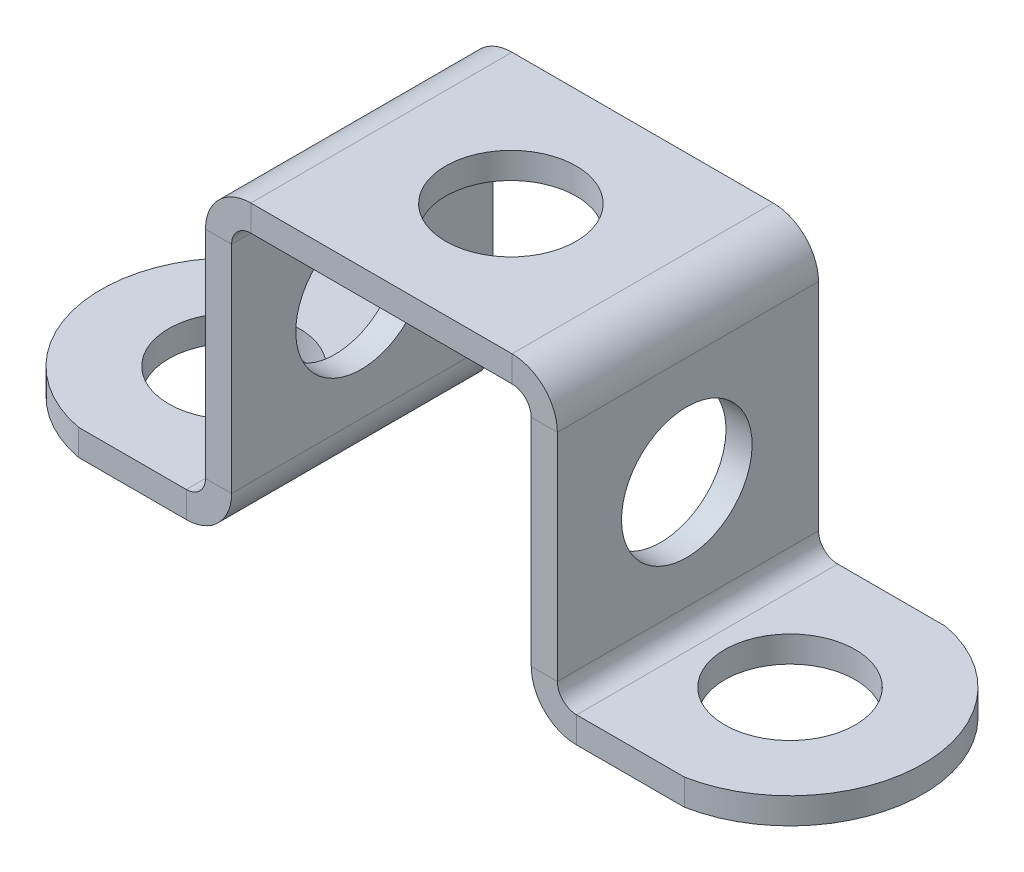
from build123d import *

# Parameters (mm, degrees)
SKETCH1_W               = 10
SKETCH1_H               = 10
BASE_FLANGE1_DEPTH      = 1
EDGE_FLANGE2_DEPTH      = 10
EDGE_FLANGE2_BEND_DEPTH = 10
EDGE_FLANGE3_DEPTH      = 10
EDGE_FLANGE3_BEND_DEPTH = 10
CUT_EXTRUDE1_DEPTH      = 10
SKETCH25_R              = 2.5
CUT_EXTRUDE2_DEPTH      = 10
SKETCH26_R              = 2.5
CUT_EXTRUDE3_DEPTH      = 10
SKETCH27_R              = 2.5
CUT_EXTRUDE4_DEPTH      = 1


# Sheet-metal steps are written as plain solids
with BuildPart() as part:
    # Sketch1 → Base-Flange1 (new body)
    with BuildSketch(Plane(origin=(0, 0, 0), x_dir=(1, 0, 0), z_dir=(0, 1, 0))):
        with Locations((0, 0.042787107)):
            Rectangle(SKETCH1_W, SKETCH1_H)
    extrude(amount=-BASE_FLANGE1_DEPTH)

    # Edge-Flange2 section (across the edge) → Edge-Flange2 (add)
    with BuildSketch(Plane(origin=(5.7366, -1, -5.042787107), x_dir=(-1, 0, 0), z_dir=(0, 0, 1))):
        with BuildLine():
            Line((-1, 0.7366), (-1, 9))
            Line((-1, 9), (0, 9))
            Line((0, 9), (0, 0.7366))
            ThreePointArc((0, 0.7366), (0.215745145, 0.215745145), (0.7366, 0))
            Line((0.7366, 0), (0.7366, -1))
            ThreePointArc((0.7366, -1), (-0.491361636, -0.491361636), (-1, 0.7366))
        make_face()
    extrude(amount=EDGE_FLANGE2_DEPTH)

    # Edge-Flange2 section 2 (across the edge) → Edge-Flange2 bend (add)
    with BuildSketch(Plane(origin=(-5.7366, -1, 4.957212893), x_dir=(1, 0, 0), z_dir=(0, 0, -1))):
        with BuildLine():
            Line((-1, 0.7366), (-1, 9))
            Line((-1, 9), (0, 9))
            Line((0, 9), (0, 0.7366))
            ThreePointArc((0, 0.7366), (0.215745145, 0.215745145), (0.7366, 0))
            Line((0.7366, 0), (0.7366, -1))
            ThreePointArc((0.7366, -1), (-0.491361636, -0.491361636), (-1, 0.7366))
        make_face()
    extrude(amount=EDGE_FLANGE2_BEND_DEPTH)

    # Edge-Flange3 section (across the edge) → Edge-Flange3 (add)
    with BuildSketch(Plane(origin=(6.7366, -10.7366, 4.957212893), x_dir=(0, 1, 0), z_dir=(0, 0, -1))):
        with BuildLine():
            Line((-1, 0.7366), (-1, 9))
            Line((-1, 9), (0, 9))
            Line((0, 9), (0, 0.7366))
            ThreePointArc((0, 0.7366), (0.215745145, 0.215745145), (0.7366, 0))
            Line((0.7366, 0), (0.7366, -1))
            ThreePointArc((0.7366, -1), (-0.491361636, -0.491361636), (-1, 0.7366))
        make_face()
    extrude(amount=EDGE_FLANGE3_DEPTH)

    # Edge-Flange3 section 2 (across the edge) → Edge-Flange3 bend (add)
    with BuildSketch(Plane(origin=(-6.7366, -10.7366, -5.042787107), x_dir=(0, 1, 0), z_dir=(0, 0, 1))):
        with BuildLine():
            Line((-1, 0.7366), (-1, 9))
            Line((-1, 9), (0, 9))
            Line((0, 9), (0, 0.7366))
            ThreePointArc((0, 0.7366), (0.215745145, 0.215745145), (0.7366, 0))
            Line((0.7366, 0), (0.7366, -1))
            ThreePointArc((0.7366, -1), (-0.491361636, -0.491361636), (-1, 0.7366))
        make_face()
    extrude(amount=EDGE_FLANGE3_BEND_DEPTH)

    # Sketch24 → Cut-Extrude1 (cut)
    with BuildSketch(Plane(origin=(0, -10.7366, 0), x_dir=(1, 0, 0), z_dir=(0, 1, 0))):
        with BuildLine():
            Line((15.7366, -4.957212893), (15.7366, 0.042787107))
            ThreePointArc((15.7366, 0.042787107), (14.57002385, -3.200318846), (11.6049, -4.957212893))
            Line((11.6049, -4.957212893), (15.7366, -4.957212893))
        make_face()
        with BuildLine():
            Line((15.7366, 5.042787107), (11.6049, 5.042787107))
            ThreePointArc((11.6049, 5.042787107), (14.57002385, 3.28589306), (15.7366, 0.042787107))
            Line((15.7366, 0.042787107), (15.7366, 5.042787107))
        make_face()
    cut_extrude1 = extrude(amount=-CUT_EXTRUDE1_DEPTH, mode=Mode.SUBTRACT)

    # Mirror1: Cut-Extrude1 across plane
    add(cut_extrude1.mirror(Plane(origin=(0, 0, 0), x_dir=(0, 0, 1), z_dir=(1, 0, 0))), mode=Mode.SUBTRACT)

    # Sketch25 → Cut-Extrude2 (cut)
    with BuildSketch(Plane(origin=(0, 0, 0), x_dir=(1, 0, 0), z_dir=(0, 1, 0))):
        with Locations(Location((0, 0, 0), (0, 0, 270))):
            Circle(SKETCH25_R)
    extrude(amount=-CUT_EXTRUDE2_DEPTH, mode=Mode.SUBTRACT)

    # Sketch26 → Cut-Extrude3 (cut)
    with BuildSketch(Plane(origin=(0, -10.7366, 0), x_dir=(1, 0, 0), z_dir=(0, 1, 0))):
        with Locations(Location((10.645360935, 0.042787107, 0), (0, 0, 270))):
            Circle(SKETCH26_R)
        with Locations(Location((-10.645360935, 0.042787107, 0), (0, 0, 270))):
            Circle(SKETCH26_R)
    extrude(amount=-CUT_EXTRUDE3_DEPTH, mode=Mode.SUBTRACT)

    # Sketch27 → Cut-Extrude4 (cut)
    with BuildSketch(Plane(origin=(6.7366, 0, 0), x_dir=(0, 0, -1), z_dir=(1, 0, 0))):
        with Locations(Location((0, -5.8683, 0), (0, 0, 90))):
            Circle(SKETCH27_R)
    cut_extrude4 = extrude(amount=-CUT_EXTRUDE4_DEPTH, mode=Mode.SUBTRACT)

    # Mirror2: Cut-Extrude4 across plane
    add(cut_extrude4.mirror(Plane(origin=(0, 0, 0), x_dir=(0, 0, 1), z_dir=(1, 0, 0))), mode=Mode.SUBTRACT)


solid = part.part
